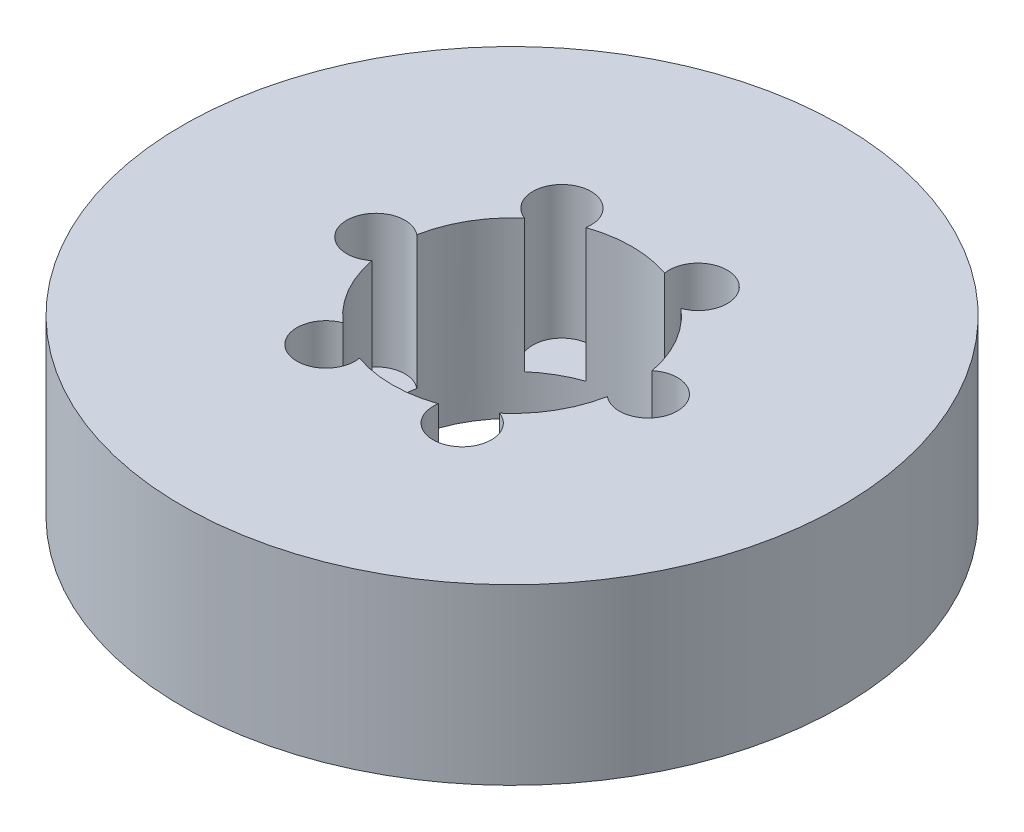
from build123d import *

# Parameters (mm, degrees)
SKETCH1_R           = 55
BOSS_EXTRUDE1_DEPTH = 29
SKETCH2_R           = 20
CUT_EXTRUDE1_DEPTH  = 84.012047318
SKETCH3_R           = 4.856906282
CUT_EXTRUDE2_DEPTH  = 22.209502637
CIRPATTERN1_COUNT   = 6


with BuildPart() as part:
    # Sketch1 → Boss-Extrude1 (new body)
    with BuildSketch(Plane(origin=(0, 0, 0), x_dir=(1, 0, 0), z_dir=(0, 1, 0))):
        Circle(SKETCH1_R)
    extrude(amount=BOSS_EXTRUDE1_DEPTH)

    # Sketch2 → Cut-Extrude1 (cut, through all)
    with BuildSketch(Plane(origin=(0, 0, 0), x_dir=(1, 0, 0), z_dir=(0, 1, 0))):
        Circle(SKETCH2_R)
    extrude(amount=CUT_EXTRUDE1_DEPTH, mode=Mode.SUBTRACT)

    # Sketch3 → Cut-Extrude2 (cut)
    with BuildSketch(Plane(origin=(0, 29, 0), x_dir=(1, 0, 0), z_dir=(0, 1, 0))):
        with Locations((-22.733839216, 0)):
            Circle(SKETCH3_R)
    cut_extrude2 = extrude(amount=-CUT_EXTRUDE2_DEPTH, mode=Mode.SUBTRACT)

    # CirPattern1: Cut-Extrude2 ×6 about axis
    cirpattern1_axis = Axis((0, 0, 0), (0, 1, 0))
    for i in range(1, CIRPATTERN1_COUNT):
        add(cut_extrude2.rotate(cirpattern1_axis, i * 360 / CIRPATTERN1_COUNT), mode=Mode.SUBTRACT)


solid = part.part
